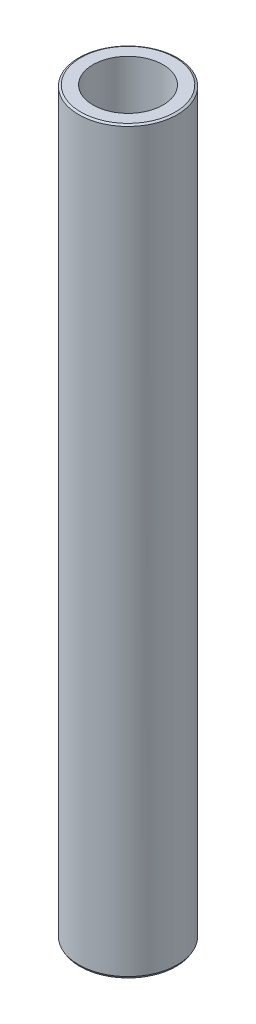
from build123d import *
from OCP.BRepFilletAPI import BRepFilletAPI_MakeChamfer

# Parameters (mm, degrees)
SKETCH1_R           = 40
BOSS_EXTRUDE1_DEPTH = 600
SKETCH2_R           = 28.400452243
CUT_EXTRUDE1_DEPTH  = 603.660766933
CHAMFER1_SIZE       = 0.964861735
CHAMFER1_SIZE2      = 1.671189547


with BuildPart() as part:
    # Sketch1 → Boss-Extrude1 (new body)
    with BuildSketch(Plane(origin=(0, 0, 0), x_dir=(1, 0, 0), z_dir=(0, 1, 0))):
        Circle(SKETCH1_R)
    extrude(amount=BOSS_EXTRUDE1_DEPTH)

    # Sketch2 → Cut-Extrude1 (cut, through all)
    with BuildSketch(Plane(origin=(0, 0, 0), x_dir=(1, 0, 0), z_dir=(0, 1, 0))):
        Circle(SKETCH2_R)
    extrude(amount=CUT_EXTRUDE1_DEPTH, mode=Mode.SUBTRACT)

    # Chamfer1: one chamfer whose edges measure the first distance from different faces: ONE call of the kernel's chamfer builder (chamfer() names one face for all edges)
    chamfer1_edges_1 = [part.edges().sort_by_distance(p)[0] for p in [
        (-40, 600, 0),
    ]]
    chamfer1_side_1 = [part.faces().sort_by_distance(p)[0] for p in [
        (-40, 300, 0),
    ]]
    chamfer1_edges_2 = [part.edges().sort_by_distance(p)[0] for p in [
        (-40, 0, 0),
    ]]
    chamfer1_side_2 = [part.faces().sort_by_distance(p)[0] for p in [
        (-38.86862915, 0, 0),
    ]]
    chamfer1 = BRepFilletAPI_MakeChamfer(part.part.solid().wrapped)
    for e in chamfer1_edges_1:
        chamfer1.Add(CHAMFER1_SIZE, CHAMFER1_SIZE2, e.wrapped, chamfer1_side_1[0].wrapped)  # the first distance lies on this face
    for e in chamfer1_edges_2:
        chamfer1.Add(CHAMFER1_SIZE, CHAMFER1_SIZE2, e.wrapped, chamfer1_side_2[0].wrapped)  # the first distance lies on this face
    add(Compound.cast(chamfer1.Shape()), mode=Mode.REPLACE)


solid = part.part
